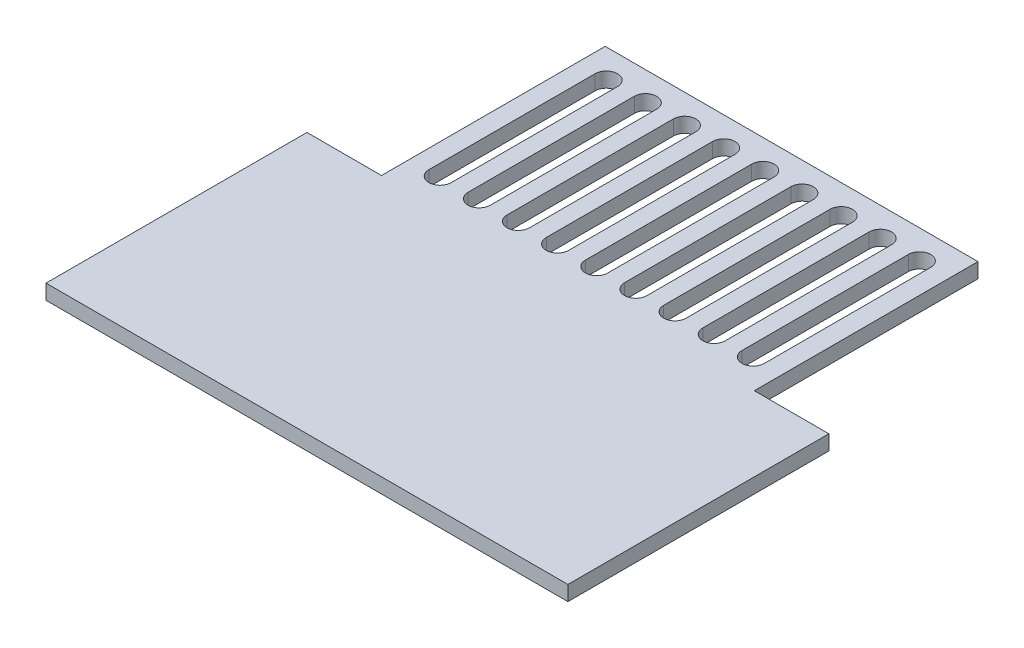
from build123d import *

# Parameters (mm, degrees)
BOSS_EXTRUDE1_DEPTH = 2


with BuildPart() as part:
    # Sketch2 → Boss-Extrude1 (new body)
    with BuildSketch(Plane(origin=(0, 0, 0), x_dir=(1, 0, 0), z_dir=(0, 1, 0))):
        Polygon((-35, 35), (-25, 35), (-25, 65), (25, 65), (25, 35), (35, 35), (35, 0), (-35, 0), align=None)
        with BuildLine():
            Line((-1.5, 38.847241674), (-1.5, 61.152758326))
            ThreePointArc((-1.5, 61.152758326), (0, 62.652758326), (1.5, 61.152758326))
            Line((1.5, 61.152758326), (1.5, 38.847241674))
            ThreePointArc((1.5, 38.847241674), (0, 37.347241674), (-1.5, 38.847241674))
        make_face(mode=Mode.SUBTRACT)
        with BuildLine():
            Line((3.75, 38.847241674), (3.75, 61.152758326))
            ThreePointArc((3.75, 61.152758326), (5.25, 62.652758326), (6.75, 61.152758326))
            Line((6.75, 61.152758326), (6.75, 38.847241674))
            ThreePointArc((6.75, 38.847241674), (5.25, 37.347241674), (3.75, 38.847241674))
        make_face(mode=Mode.SUBTRACT)
        with BuildLine():
            Line((9, 38.847241674), (9, 61.152758326))
            ThreePointArc((9, 61.152758326), (10.5, 62.652758326), (12, 61.152758326))
            Line((12, 61.152758326), (12, 38.847241674))
            ThreePointArc((12, 38.847241674), (10.5, 37.347241674), (9, 38.847241674))
        make_face(mode=Mode.SUBTRACT)
        with BuildLine():
            Line((14.25, 38.847241674), (14.25, 61.152758326))
            ThreePointArc((14.25, 61.152758326), (15.75, 62.652758326), (17.25, 61.152758326))
            Line((17.25, 61.152758326), (17.25, 38.847241674))
            ThreePointArc((17.25, 38.847241674), (15.75, 37.347241674), (14.25, 38.847241674))
        make_face(mode=Mode.SUBTRACT)
        with BuildLine():
            Line((19.5, 38.847241674), (19.5, 61.152758326))
            ThreePointArc((19.5, 61.152758326), (21, 62.652758326), (22.5, 61.152758326))
            Line((22.5, 61.152758326), (22.5, 38.847241674))
            ThreePointArc((22.5, 38.847241674), (21, 37.347241674), (19.5, 38.847241674))
        make_face(mode=Mode.SUBTRACT)
        with BuildLine():
            Line((-6.75, 38.847241674), (-6.75, 61.152758326))
            ThreePointArc((-6.75, 61.152758326), (-5.25, 62.652758326), (-3.75, 61.152758326))
            Line((-3.75, 61.152758326), (-3.75, 38.847241674))
            ThreePointArc((-3.75, 38.847241674), (-5.25, 37.347241674), (-6.75, 38.847241674))
        make_face(mode=Mode.SUBTRACT)
        with BuildLine():
            Line((-12, 38.847241674), (-12, 61.152758326))
            ThreePointArc((-12, 61.152758326), (-10.5, 62.652758326), (-9, 61.152758326))
            Line((-9, 61.152758326), (-9, 38.847241674))
            ThreePointArc((-9, 38.847241674), (-10.5, 37.347241674), (-12, 38.847241674))
        make_face(mode=Mode.SUBTRACT)
        with BuildLine():
            Line((-17.25, 38.847241674), (-17.25, 61.152758326))
            ThreePointArc((-17.25, 61.152758326), (-15.75, 62.652758326), (-14.25, 61.152758326))
            Line((-14.25, 61.152758326), (-14.25, 38.847241674))
            ThreePointArc((-14.25, 38.847241674), (-15.75, 37.347241674), (-17.25, 38.847241674))
        make_face(mode=Mode.SUBTRACT)
        with BuildLine():
            Line((-22.5, 38.847241674), (-22.5, 61.152758326))
            ThreePointArc((-22.5, 61.152758326), (-21, 62.652758326), (-19.5, 61.152758326))
            Line((-19.5, 61.152758326), (-19.5, 38.847241674))
            ThreePointArc((-19.5, 38.847241674), (-21, 37.347241674), (-22.5, 38.847241674))
        make_face(mode=Mode.SUBTRACT)
    extrude(amount=BOSS_EXTRUDE1_DEPTH)


solid = part.part
